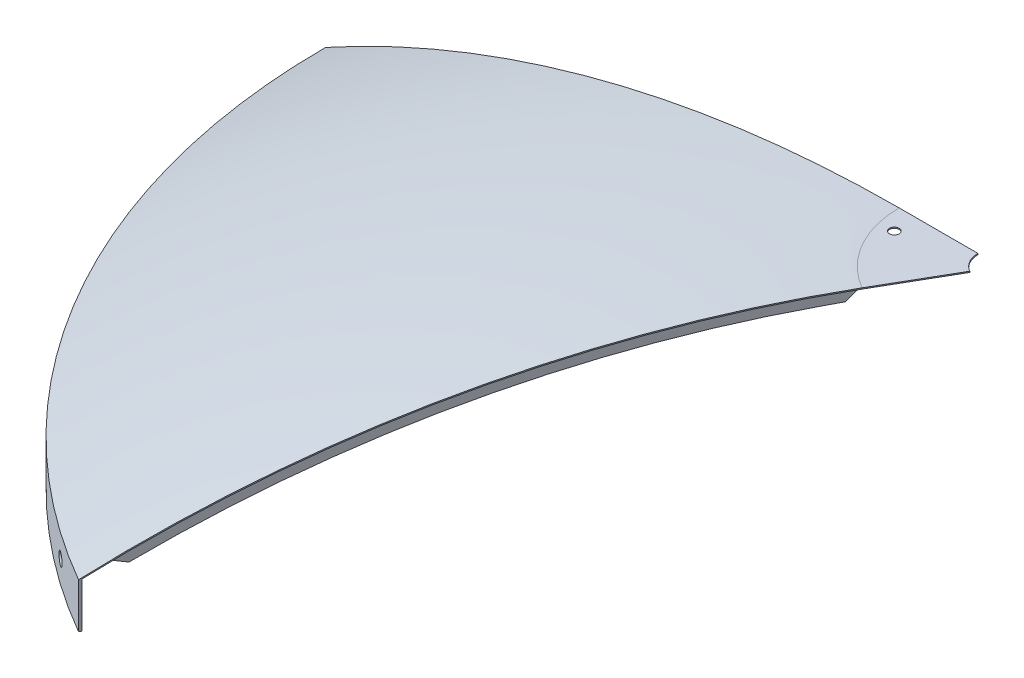
from build123d import *

# Parameters (mm, degrees)
REVOLVE1_ANGLE           = 60
BOSS_EXTRUDE2_DEPTH      = 3
SKETCH6_R                = 2.15
CUT_EXTRUDE4_DEPTH       = 406.663539261
SKETCH7_R                = 2.75
CUT_EXTRUDE5_DEPTH       = 385.223552396
BOSS_EXTRUDE3_REACH      = 384.105
BOSS_EXTRUDE3_END_RADIUS = 298.540246695
SKETCH8_W                = 20
SKETCH8_H                = 20
SKETCH8_R                = 5.5
CHAMFER2_START           = -83.211034879
CHAMFER2_DEPTH           = 20
CIRPATTERN1_COUNT        = 6
CIRPATTERN1_ANGLE        = 50


with BuildPart() as part:
    # Sketch1 → Revolve1 (revolve)
    with BuildSketch(Plane.XY):
        with BuildLine():
            Line((-45, 1.936673673), (-10, 1.936673673))
            Line((-10, 1.936673673), (-10, 2.436673673))
            Line((-10, 2.436673673), (-45.000375853, 2.436673673))
            ThreePointArc((-45.000375853, 2.436673673), (-45.557674224, 2.435543108), (-46.114971099, 2.433826721))
            ThreePointArc((-46.114971099, 2.433826721), (-177.046295247, -14.475660779), (-299.740246695, -63.211034879))
            Line((-299.740246695, -63.211034879), (-299.740246695, -83.211034879))
            Line((-299.740246695, -83.211034879), (-298.540246695, -83.211034879))
            Line((-298.540246695, -83.211034879), (-298.540246695, -63.122850002))
            ThreePointArc((-298.540246695, -63.122850002), (-176.391431697, -14.82293294), (-46.11316839, 1.933829971))
            ThreePointArc((-46.11316839, 1.933829971), (-45.556584942, 1.935544259), (-45, 1.936673673))
        make_face()
    revolve(axis=Axis((0, -998.5, 0), (0, 1, 0)), revolution_arc=REVOLVE1_ANGLE)

    # Sketch5 → Boss-Extrude2 (add)
    with BuildSketch(Plane(origin=(-1.299038106, 0, -0.75), x_dir=(0.49999999999999806, 1.7151244994428766e-15, -0.8660254037844398), z_dir=(0.8660254037844397, 2.9706827743412166e-15, 0.499999999999998))):
        with BuildLine():
            Line((-45, 1.936673673), (-49.96611414, -3.044398734))
            Line((-49.96611414, -3.044398734), (-57.205491825, -3.223856824))
            ThreePointArc((-57.205491825, -3.223856824), (-173.29403062, -19.19162867), (-282.943092833, -60.526864646))
            Line((-282.943092833, -60.526864646), (-289.723636747, -58.404016564))
            ThreePointArc((-289.723636747, -58.404016564), (-171.003425767, -13.464410412), (-45, 1.936673673))
        make_face()
    boss_extrude2 = extrude(amount=-BOSS_EXTRUDE2_DEPTH)

    # Mirror1: Boss-Extrude2 across plane
    add(boss_extrude2.mirror(Plane(origin=(0, 0, 0), x_dir=(-0.8660254037844385, -2.970682774341212e-15, 0.5000000000000006), z_dir=(0.5000000000000009, 1.7151244994428864e-15, 0.8660254037844383))))

    # Sketch6 → Cut-Extrude4 (cut, through all)
    with BuildSketch(Plane(origin=(0, 2.436673673, 0), x_dir=(1, 0, 0), z_dir=(0, 1, 0))):
        with Locations(Location((-37.188144312, -9.964533236, 0), (0, 0, 180))):
            Circle(SKETCH6_R)
    extrude(amount=-CUT_EXTRUDE4_DEPTH, mode=Mode.SUBTRACT)

    # Sketch7 → Cut-Extrude5 (cut, through all)
    with BuildSketch(Plane(origin=(-298.599644562, 0, 26.124083832), x_dir=(0.08715574274765836, 0, 0.9961946980917455), z_dir=(-0.9961946980917457, -3.417195865824524e-15, 0.08715574274765837))):
        with Locations((0, -73.211034879)):
            Circle(SKETCH7_R)
    cut_extrude5 = extrude(amount=-CUT_EXTRUDE5_DEPTH, mode=Mode.SUBTRACT)

    # Boss-Extrude3: up to this cylinder (the profile starts inside it)
    boss_extrude3_end = Plane(origin=(0, -82.928192, 0), z_dir=(0, -1, 0)) * Cylinder(BOSS_EXTRUDE3_END_RADIUS, 1366.29049339, mode=Mode.PRIVATE)
    # Sketch8 → Boss-Extrude3 (add, up to the surface)
    with BuildSketch(Plane(origin=(-295.611060468, 0, 25.862616604), x_dir=(0.08715574274765836, 0, 0.9961946980917455), z_dir=(-0.9961946980917457, -3.417195865824524e-15, 0.08715574274765837)), mode=Mode.PRIVATE) as boss_extrude3_sk1:
        with Locations((0, -73.211034879)):
            Rectangle(SKETCH8_W, SKETCH8_H)
        with Locations(Location((0, -73.211034879, 0), (0, 0, 180))):
            Circle(SKETCH8_R, mode=Mode.SUBTRACT)
    boss_extrude3_tool1 = extrude(boss_extrude3_sk1.sketch, amount=BOSS_EXTRUDE3_REACH, mode=Mode.PRIVATE) & boss_extrude3_end
    boss_extrude3 = boss_extrude3_tool1.solids().sort_by_distance((-295.61106, -82.928192, 25.862617))[0]
    add(boss_extrude3)

    # Chamfer2: read off the stored shape, not the designer's step
    # Chamfer2 outline → Chamfer2 (add)
    with BuildSketch(Plane(origin=(0, 0, 0), x_dir=(1, 0, 0), z_dir=(0, 1, 0)).offset(CHAMFER2_START)):
        with BuildLine():
            ThreePointArc((-296.365762383, -35.966842841), (-296.185484291, -37.422423656), (-295.998057253, -38.877101217))
            Line((-295.998057253, -38.877101217), (-294.617841474, -37.215161658))
            Line((-294.617841474, -37.215161658), (-294.739503041, -35.824563585))
            Line((-294.739503041, -35.824563585), (-296.365762383, -35.966842841))
        make_face()
        with BuildLine():
            ThreePointArc((-298.252119439, -13.113052542), (-298.184096931, -14.578176645), (-298.108877238, -16.042948879))
            Line((-298.108877238, -16.042948879), (-296.482617896, -15.900669623))
            Line((-296.482617896, -15.900669623), (-296.604279462, -14.510071549))
            Line((-296.604279462, -14.510071549), (-298.252119439, -13.113052542))
        make_face()
    chamfer2 = extrude(amount=CHAMFER2_DEPTH)

    # CirPattern1: Cut-Extrude5, Boss-Extrude3, Chamfer2 ×6 about axis
    cirpattern1_axis = Axis((0, 0, 0), (0, 1, 0))
    add([cut_extrude5.rotate(cirpattern1_axis, i * CIRPATTERN1_ANGLE / (CIRPATTERN1_COUNT - 1)) for i in range(1, CIRPATTERN1_COUNT)], mode=Mode.SUBTRACT)
    add([boss_extrude3.rotate(cirpattern1_axis, i * CIRPATTERN1_ANGLE / (CIRPATTERN1_COUNT - 1)) for i in range(1, CIRPATTERN1_COUNT)])
    add([chamfer2.rotate(cirpattern1_axis, i * CIRPATTERN1_ANGLE / (CIRPATTERN1_COUNT - 1)) for i in range(1, CIRPATTERN1_COUNT)])


solid = part.part
